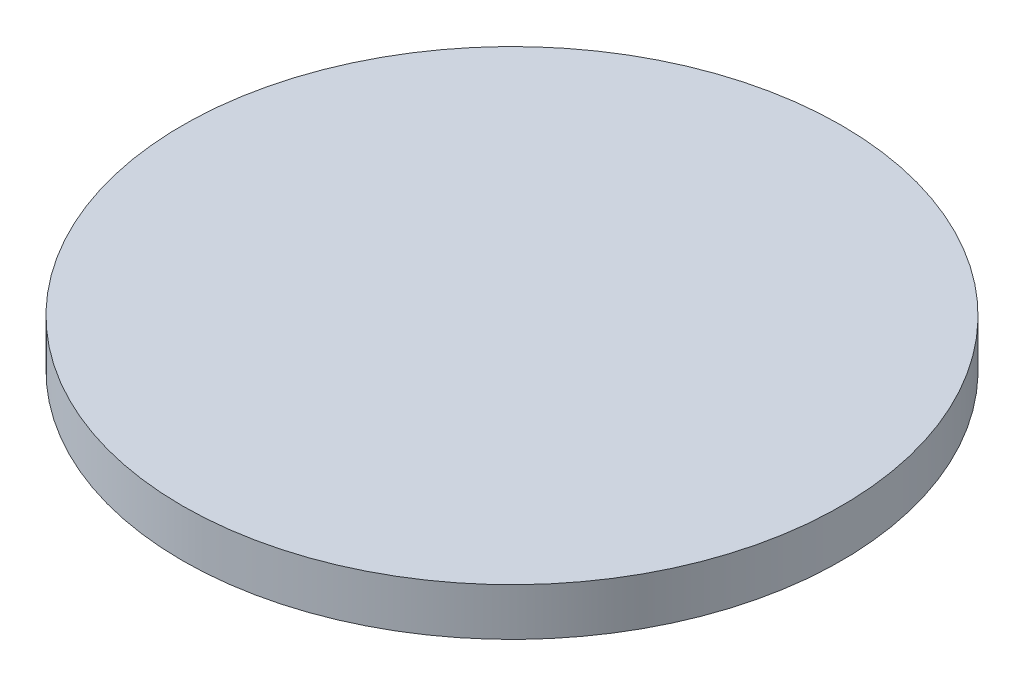
from build123d import *

# Parameters (mm, degrees)
F_3DSKETCH1_R       = 5.905928955
BOSS_EXTRUDE1_DEPTH = 0.85


with BuildPart() as part:
    # 3DSketch1 → Boss-Extrude1 (new body)
    with BuildSketch(Plane(origin=(0, 97.349896231, 0), x_dir=(0, 0, -1), z_dir=(0, -1, 0))):
        Circle(F_3DSKETCH1_R)
    extrude(amount=-BOSS_EXTRUDE1_DEPTH)


solid = part.part
